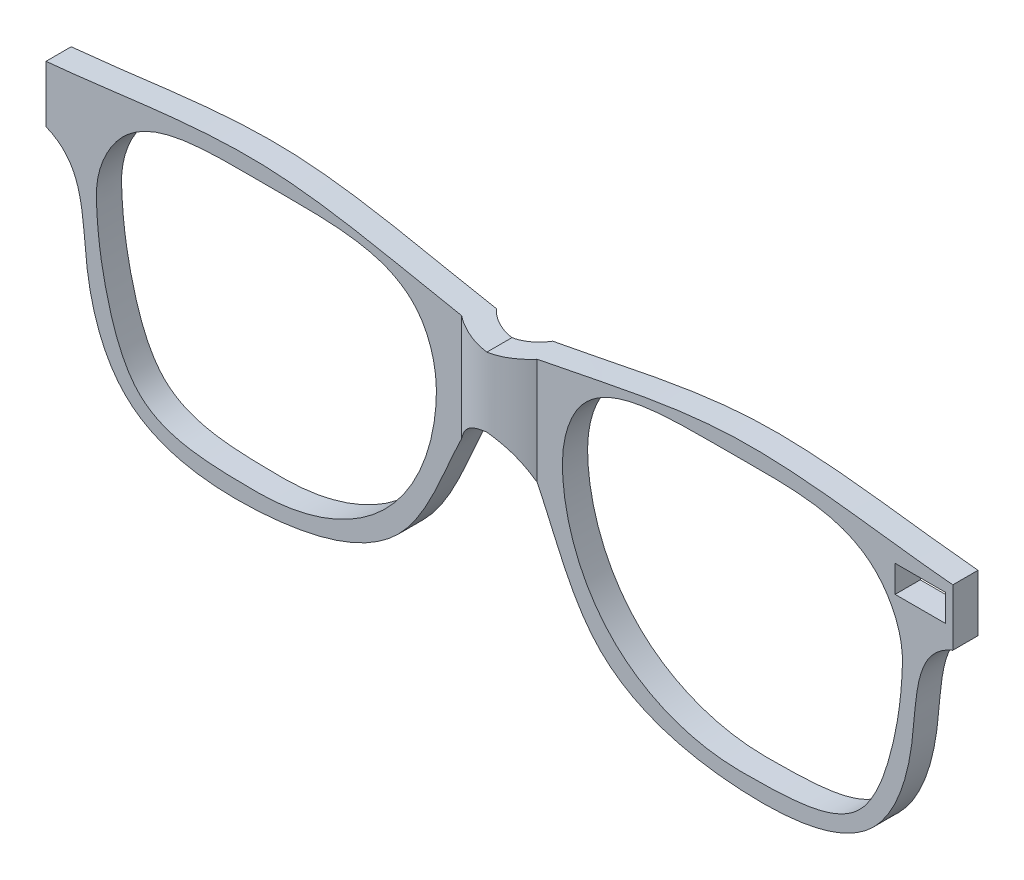
from build123d import *

# Parameters (mm, degrees)
BOSS_EXTRUDE2_START = -10
BOSS_EXTRUDE2_DEPTH = 58
CUT_EXTRUDE1_DEPTH  = 48
CUT_EXTRUDE3_DEPTH  = 48
SKETCH7_W           = 3
SKETCH7_H           = 3
BOSS_EXTRUDE4_DEPTH = 2
FILLET1_R           = 0.5
SKETCH8_R           = 0.5
CUT_EXTRUDE4_DEPTH  = 3
SKETCH9_W           = 8
SKETCH9_H           = 4.275705382
CUT_EXTRUDE6_DEPTH  = 86.382960974


# Read off the part's stored shape, not the designer's step: Mirror3
with BuildPart() as part:
    # Sketch2 → Boss-Extrude2 (new body)
    with BuildSketch(Plane(origin=(0, 0, 0), x_dir=(1, 0, 0), z_dir=(0, 1, 0)).offset(BOSS_EXTRUDE2_START)):
        with BuildLine():
            Line((6, 2), (72, 2))
            Line((72, 2), (72, 6))
            Line((72, 6), (4.472135955, 6))
            ThreePointArc((4.472135955, 6), (2.449489743, 4.522774425), (0, 4))
            Line((0, 4), (0, 0))
            ThreePointArc((0, 0), (3.16227766, 0.513167019), (6, 2))
        make_face()
    boss_extrude2 = extrude(amount=BOSS_EXTRUDE2_DEPTH)

    # Sketch4 → Cut-Extrude1 (cut)
    with BuildSketch(Plane.XY):
        with BuildLine():
            Line((75.181024804, -21.70251563), (72, 33.5))
            add(Edge.make_bspline(
                [(72, 33.5), (65.733895707, 30.986863851), (66.897988293, 17.744017336), (60.184304866, -1.408989634), (37.041632207, -3.974195098), (14.79772784, 1.928607021), (8.326301166, 19.085602566), (3.971434767, 27.945368893), (0, 28.5)],
                knots=[0, 0, 0, 0, 0.166940083, 0.318250601, 0.518054161, 0.734725038, 0.904637492, 1, 1, 1, 1], degree=3))
            Line((0, 28.5), (-1.793667206, -21.70251563))
            Line((-1.793667206, -21.70251563), (75.181024804, -21.70251563))
        make_face()
        with BuildLine():
            Line((0, 39.5), (0, 66.878987003))
            Line((0, 66.878987003), (72, 65.421074967))
            Line((72, 65.421074967), (72, 42.5))
            add(Edge.make_bspline(
                [(0, 39.5), (12.28727979, 41.355933166), (36.181117827, 48.373206471), (60.430055597, 43.550313065), (72, 42.5)],
                knots=[0, 0, 0, 0, 0.516941008, 1, 1, 1, 1], degree=3))
        make_face()
    cut_extrude1 = extrude(amount=-CUT_EXTRUDE1_DEPTH, mode=Mode.SUBTRACT)

    # Sketch3 → Cut-Extrude3 (cut)
    with BuildSketch(Plane.XY):
        with BuildLine():
            add(Edge.make_bspline(
                [(39, 43), (47.455166281, 43.034379293), (58.672301943, 43.086153016), (64.123941507, 31.567507143), (63.869059347, 23.047129354), (62.634483109, 14.698309693), (57.380279449, 0.640489267), (45.579929681, 0.061052081), (30.647288037, -0.10197224), (16.378399599, 5.905052669), (10.27410697, 19.960221638), (9.855802774, 30.870699355), (13.540960725, 43.329764048), (27.180471598, 42.952614894), (37.93578121, 42.995672813), (39, 43)],
                knots=[0, 0, 0, 0, 0.137810111, 0.19969144, 0.215595383, 0.296849548, 0.368224057, 0.474166526, 0.500284011, 0.629398899, 0.753161556, 0.772876045, 0.82654379, 0.982654379, 1, 1, 1, 1], degree=3))
        make_face()
    cut_extrude3 = extrude(amount=-CUT_EXTRUDE3_DEPTH, mode=Mode.SUBTRACT)

    # Mirror2: Boss-Extrude2, Cut-Extrude1, Cut-Extrude3 across plane
    add(boss_extrude2.mirror(Plane(origin=(0, 0, 0), x_dir=(0, 0, 1), z_dir=(1, 0, 0))))
    add(cut_extrude1.mirror(Plane(origin=(0, 0, 0), x_dir=(0, 0, 1), z_dir=(1, 0, 0))), mode=Mode.SUBTRACT)
    add(cut_extrude3.mirror(Plane(origin=(0, 0, 0), x_dir=(0, 0, 1), z_dir=(1, 0, 0))), mode=Mode.SUBTRACT)

    # Sketch7 → Boss-Extrude4 (add)
    with BuildSketch(Plane(origin=(0, 0, -6), x_dir=(-1, 0, 0), z_dir=(0, 0, -1))):
        with Locations((-68.5, 38)):
            Rectangle(SKETCH7_W, SKETCH7_H)
    extrude(amount=BOSS_EXTRUDE4_DEPTH)

    # Fillet1
    fillet1_edges = [part.edges().sort_by_distance(p)[0] for p in [
        (70, 38, -8),
        (68.5, 36.5, -8),
        (67, 38, -8),
        (68.5, 39.5, -8),
    ]]
    fillet(fillet1_edges, radius=FILLET1_R)

    # Sketch8 → Cut-Extrude4 (cut)
    with BuildSketch(Plane(origin=(0, 39.5, 0), x_dir=(1, 0, 0), z_dir=(0, 1, 0))):
        with Locations(Location((68.5, 7, 0), (0, 0, 90))):
            Circle(SKETCH8_R)
    extrude(amount=-CUT_EXTRUDE4_DEPTH, mode=Mode.SUBTRACT)

    # Mirror3: part across plane


with BuildPart() as part_1:
    add(part.part)
    add(part.part.mirror(Plane(origin=(0, 0, 0), x_dir=(0, 0, 1), z_dir=(1, 0, 0))))

    # Sketch9 → Cut-Extrude6 (cut, through all)
    with BuildSketch(Plane.XY.offset(-2)):
        with Locations((66.83752114, 38.743681376)):
            Rectangle(SKETCH9_W, SKETCH9_H)
    extrude(amount=-CUT_EXTRUDE6_DEPTH, mode=Mode.SUBTRACT)


solid = part_1.part
